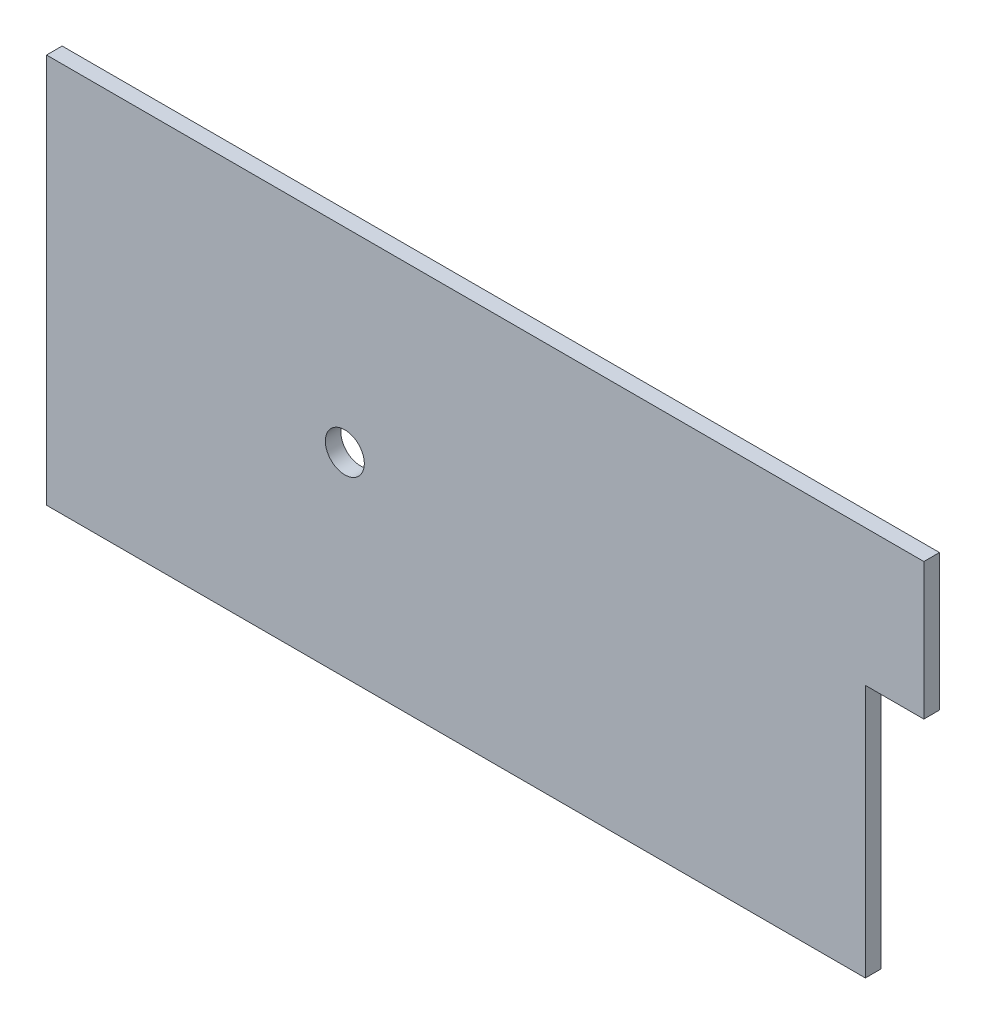
from build123d import *

# Parameters (mm, degrees)
SKETCH1_R           = 5
BOSS_EXTRUDE1_DEPTH = 4


with BuildPart() as part:
    # Sketch1 → Boss-Extrude1 (new body)
    with BuildSketch(Plane.XY):
        Polygon((60, 50), (75, 50), (75, 15), (60, 15), (60, -50), (-150, -50), (-150, 50), align=None)
        with Locations((-73.5, 0)):
            Circle(SKETCH1_R, mode=Mode.SUBTRACT)
    extrude(amount=BOSS_EXTRUDE1_DEPTH)


solid = part.part
